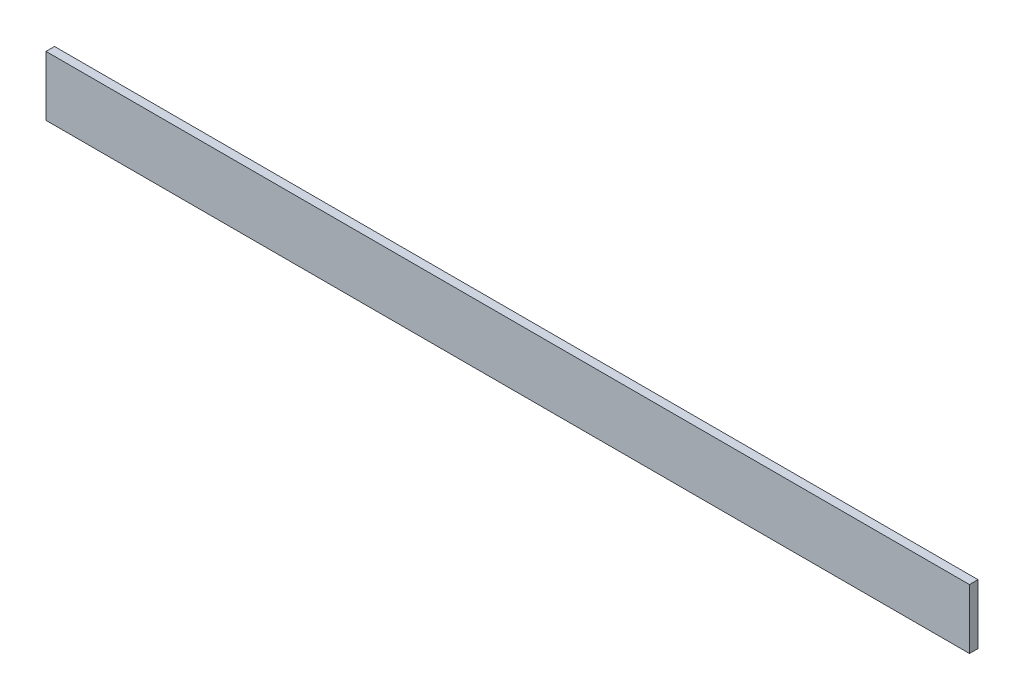
from build123d import *

# Parameters (mm, degrees)
SKETCH_2_W             = 1082
SKETCH_2_H             = 70
SM_BASE_FLANGE_1_DEPTH = 10


# Sheet-metal steps are written as plain solids
with BuildPart() as part:
    # Sketch 2 → 基体-法兰1 (new body)
    with BuildSketch(Plane.XY):
        Rectangle(SKETCH_2_W, SKETCH_2_H)
    extrude(amount=-SM_BASE_FLANGE_1_DEPTH)


solid = part.part
